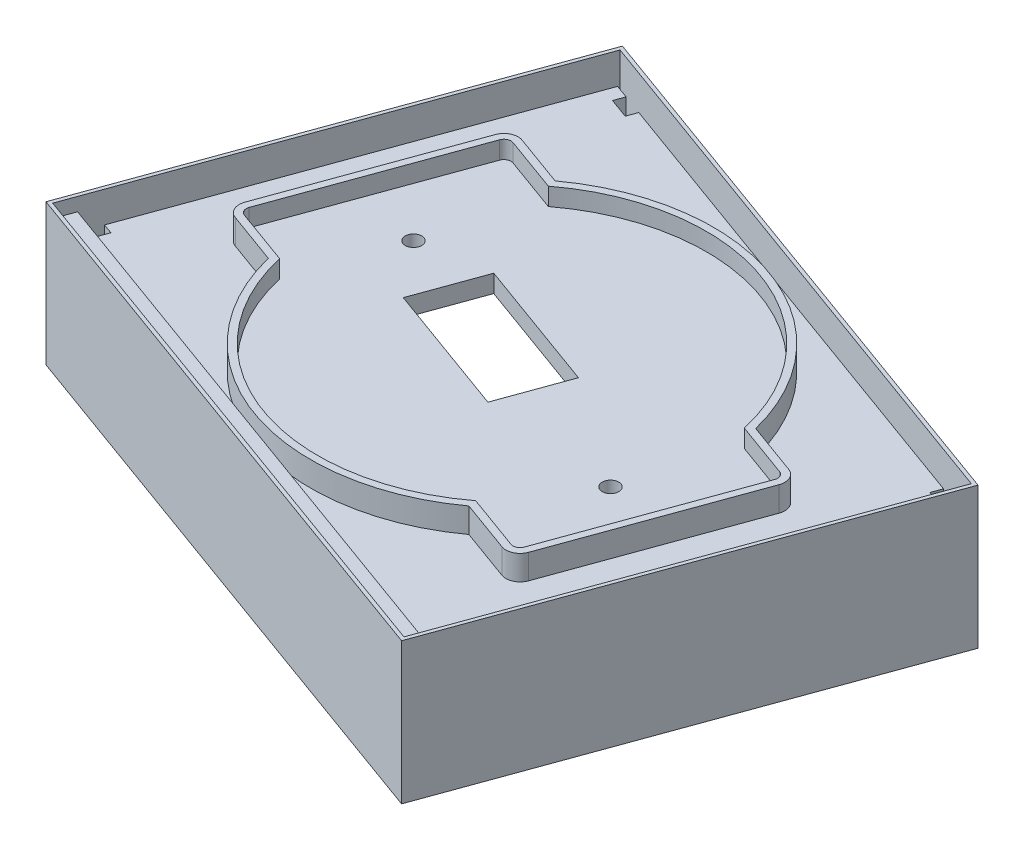
from build123d import *

# Parameters (mm, degrees)
EXTRUDE_1_DEPTH      = 50
SHELL_1_T            = -5
EXTRUDE_2_DEPTH      = 5
SKETCH_10_R          = 2.35
EXTRUDE_3_DEPTH      = 5
CUT_EXTRUDE_1_DEPTH  = 5
EXTRUDE_START        = -30
EXTRUDE_4_DEPTH      = 30
SHELL_START          = -13
SHELL_13_DEPTH       = 8
SHELL_START_2        = -43
SHELL_13_2_DEPTH     = 30
SHELL_13_3_OUTLINE_R = 4.35
SHELL_13_3_DEPTH     = 1
SHELL_START_3        = -8
SHELL_13_4_DEPTH     = 3
SHELL_START_4        = -5
SHELL_13_5_DEPTH     = 3
SHELL_13_6_DEPTH     = 26
CUT_EXTRUDE_2_DEPTH  = 144.120865122
CUT_EXTRUDE_3_DEPTH  = 5


# Read off the part's stored shape, not the designer's step: 凸台-拉伸4, 抽壳13
with BuildPart() as part:
    # 草图3 → 凸台-拉伸1 (new body)
    with BuildSketch(Plane(origin=(0, 0, 0), x_dir=(1, 0, 0), z_dir=(0, 1, 0))):
        Polygon((57.849497127, -89.790549593), (-101.961949946, -31.82244298), (-57.849497127, 89.790549593), (101.961949946, 31.82244298), align=None)
    extrude(amount=-EXTRUDE_1_DEPTH)

    # 抽壳1
    shell_1_openings = [part.faces().sort_by_distance(p)[0] for p in [
        (0, 0, 0),
    ]]
    offset(amount=SHELL_1_T, openings=shell_1_openings, kind=Kind.INTERSECTION)

    # 草图4 → 凸台-拉伸2 (add)
    with BuildSketch(Plane(origin=(0, -10, 0), x_dir=(1, 0, 0), z_dir=(0, 1, 0))):
        Polygon((-54.85410476, 83.385268602), (95.556668956, 28.827050613), (54.793783145, -83.551568403), (-95.616990571, -28.993350414), align=None)
        with BuildLine():
            Line((-33.405753886, 43.6927409), (-49.102625926, 49.386437869))
            ThreePointArc((-49.102625926, 49.386437869), (-50.631828553, 49.317990247), (-51.664738322, 48.188280923))
            Line((-51.664738322, 48.188280923), (-70.544015322, -3.859728807))
            ThreePointArc((-70.544015322, -3.859728807), (-70.4755677, -5.388931433), (-69.345858375, -6.421841203))
            Line((-69.345858375, -6.421841203), (-53.648986335, -12.115538173))
            ThreePointArc((-53.648986335, -12.115538173), (-18.754387434, -51.703703465), (33.405753886, -43.6927409))
            Line((33.405753886, -43.6927409), (49.102625926, -49.386437869))
            ThreePointArc((49.102625926, -49.386437869), (50.631828553, -49.317990247), (51.664738322, -48.188280923))
            Line((51.664738322, -48.188280923), (70.544015322, 3.859728807))
            ThreePointArc((70.544015322, 3.859728807), (70.4755677, 5.388931433), (69.345858375, 6.421841203))
            Line((69.345858375, 6.421841203), (53.648986335, 12.115538173))
            ThreePointArc((53.648986335, 12.115538173), (18.754387434, 51.703703465), (-33.405753886, 43.6927409))
        make_face(mode=Mode.SUBTRACT)
    extrude(amount=EXTRUDE_2_DEPTH)

    # 草图10 → 凸台-拉伸3 (add)
    with BuildSketch(Plane(origin=(0, -10, 0), x_dir=(1, 0, 0), z_dir=(0, 1, 0))):
        Polygon((-54.85410476, 83.385268602), (95.556668956, 28.827050613), (54.87017905, -83.340953621), (-95.540594666, -28.782735632), align=None)
        with Locations(Location((44.109349089, -16.22853422, 0), (0, 0, 270))):
            Circle(SKETCH_10_R, mode=Mode.SUBTRACT)
        with Locations(Location((-44.109349089, 16.22853422, 0), (0, 0, 270))):
            Circle(SKETCH_10_R, mode=Mode.SUBTRACT)
        Polygon((5.990784733, -12.810561982), (-31.611908696, 0.828992516), (-24.792131447, 19.63033923), (12.810561982, 5.990784733), align=None, mode=Mode.SUBTRACT)
    extrude(amount=-EXTRUDE_3_DEPTH)

    # 草图11 → 切除-拉伸1 (cut)
    with BuildSketch(Plane(origin=(0, -45, 0), x_dir=(1, 0, 0), z_dir=(0, 1, 0))):
        Polygon((57.849497127, -89.790549593), (101.961949946, 31.82244298), (-57.849497127, 89.790549593), (-101.961949946, -31.82244298), align=None)
    extrude(amount=-CUT_EXTRUDE_1_DEPTH, mode=Mode.SUBTRACT)

    # 凸台-拉伸4 outline → 凸台-拉伸4 (add)
    # profile 1 of 4: a face of its own
    with BuildSketch(Plane.XZ.offset(45).offset(EXTRUDE_START)):
        Polygon((92.146780331, -19.426377256), (82.746106974, -22.83626588), (86.155995598, -32.236939238), (95.556668956, -28.827050613), align=None)
        Polygon((91.713500361, -27.029815193), (87.953231018, -28.393770643), (86.589275569, -24.6335013), (90.349544911, -23.26954585), align=None, mode=Mode.SUBTRACT)
    # profile 2 of 4: a face of its own
    with BuildSketch(Plane.XZ.offset(45).offset(EXTRUDE_START)):
        Polygon((-54.85410476, -83.385268602), (-45.453403196, -79.975369746), (-48.863293462, -70.574691864), (-58.263966819, -73.984580488), align=None)
        Polygon((-49.296573432, -78.178129801), (-53.056842775, -79.542085251), (-54.420798224, -75.781815908), (-50.660528881, -74.417860458), align=None, mode=Mode.SUBTRACT)
    # profile 3 of 4: a face of its own
    with BuildSketch(Plane.XZ.offset(45).offset(EXTRUDE_START)):
        Polygon((49.11739228, 70.666865773), (58.263993385, 73.984595245), (54.87017905, 83.340953621), (54.85410476, 83.385268602), (45.453431403, 79.975379978), align=None)
        Polygon((50.660555447, 74.417875215), (49.296599998, 78.178144558), (53.05686934, 79.542100008), (54.42082479, 75.781830665), align=None, mode=Mode.SUBTRACT)
    # profile 4 of 4: a face of its own
    with BuildSketch(Plane.XZ.offset(45).offset(EXTRUDE_START)):
        Polygon((-95.540594666, 28.782735632), (-92.146780332, 19.426377256), (-82.746106974, 22.83626588), (-86.155995598, 32.236939238), (-95.556668956, 28.827050613), align=None)
        Polygon((-91.713500361, 27.029815193), (-87.953231018, 28.393770643), (-86.589275569, 24.6335013), (-90.349544911, 23.26954585), align=None, mode=Mode.SUBTRACT)
    extrude(amount=EXTRUDE_4_DEPTH)

    # 抽壳13 outline → 抽壳13 (cut)
    with BuildSketch(Plane(origin=(0, 0, 0), x_dir=(1, 0, 0), z_dir=(0, 1, 0)).offset(SHELL_START)):
        Polygon((-99.39983755, -30.624286033), (56.65134018, -87.228437197), (99.39983755, 30.624286033), (-56.65134018, 87.228437197), align=None)
        Polygon((57.432291447, -82.142796675), (56.052261707, -85.947380999), (-98.118781352, -30.02520756), (-96.738751612, -26.220623236), align=None, mode=Mode.SUBTRACT)
        with BuildLine():
            Line((-72.424149993, -3.177751082), (-53.544872994, 48.870258648))
            ThreePointArc((-53.544872994, 48.870258648), (-51.479053454, 51.129677297), (-48.420648201, 51.266572541))
            Line((-48.420648201, 51.266572541), (-33.739920947, 45.941459864))
            ThreePointArc((-33.739920947, 45.941459864), (19.436365158, 53.583838136), (55.347108846, 13.627088551))
            Line((55.347108846, 13.627088551), (70.0278361, 8.301975874))
            ThreePointArc((70.0278361, 8.301975874), (72.28725475, 6.236156335), (72.424149993, 3.177751082))
            Line((72.424149993, 3.177751082), (53.544872994, -48.870258648))
            ThreePointArc((53.544872994, -48.870258648), (51.479053454, -51.129677297), (48.420648201, -51.266572541))
            Line((48.420648201, -51.266572541), (33.739920947, -45.941459864))
            ThreePointArc((33.739920947, -45.941459864), (-19.436365158, -53.583838136), (-55.347108846, -13.627088551))
            Line((-55.347108846, -13.627088551), (-70.0278361, -8.301975874))
            ThreePointArc((-70.0278361, -8.301975874), (-72.28725475, -6.236156335), (-72.424149993, -3.177751082))
        make_face(mode=Mode.SUBTRACT)
    extrude(amount=SHELL_13_DEPTH, mode=Mode.SUBTRACT)

    # Shell 13 2 outline → Shell 13 2 (cut)
    with BuildSketch(Plane(origin=(0, 0, 0), x_dir=(1, 0, 0), z_dir=(0, 1, 0)).offset(SHELL_START_2)):
        Polygon((-99.39983755, -30.624286033), (56.65134018, -87.228437197), (99.39983755, 30.624286033), (-56.65134018, 87.228437197), align=None)
        Polygon((56.641948324, -75.523741054), (54.612089439, -81.119830088), (57.432291447, -82.142796675), (56.052261707, -85.947380999), (-98.118781352, -30.02520756), (-96.738751612, -26.220623236), (-93.918549605, -27.243589823), (-91.88869072, -21.64750079), (-94.708892728, -20.624534203), (-56.052261707, 85.947380999), (-52.291964157, 84.583415318), (-53.314932385, 81.763208785), (-47.674528371, 79.71727561), (-46.651560142, 82.537482143), (88.718107995, 33.435096184), (87.695141407, 30.614894177), (94.275612757, 28.22797214), (91.88869072, 21.64750079), (94.708892728, 20.624534203), (59.462150331, -76.546707641), align=None, mode=Mode.SUBTRACT)
    extrude(amount=SHELL_13_2_DEPTH, mode=Mode.SUBTRACT)

    # Shell 13 3 outline → Shell 13 3 (cut)
    with BuildSketch(Plane(origin=(0, 0, 0), x_dir=(1, 0, 0), z_dir=(0, 1, 0)).offset(SHELL_START)):
        with BuildLine():
            ThreePointArc((-48.420648201, 51.266572541), (-51.479053454, 51.129677297), (-53.544872994, 48.870258648))
            Line((-53.544872994, 48.870258648), (-72.424149993, -3.177751082))
            ThreePointArc((-72.424149993, -3.177751082), (-72.28725475, -6.236156335), (-70.0278361, -8.301975874))
            Line((-70.0278361, -8.301975874), (-55.347108846, -13.627088551))
            ThreePointArc((-55.347108846, -13.627088551), (-19.436365158, -53.583838136), (33.739920947, -45.941459864))
            Line((33.739920947, -45.941459864), (48.420648201, -51.266572541))
            ThreePointArc((48.420648201, -51.266572541), (51.479053454, -51.129677297), (53.544872994, -48.870258648))
            Line((53.544872994, -48.870258648), (72.424149993, 3.177751082))
            ThreePointArc((72.424149993, 3.177751082), (72.28725475, 6.236156335), (70.0278361, 8.301975874))
            Line((70.0278361, 8.301975874), (55.347108846, 13.627088551))
            ThreePointArc((55.347108846, 13.627088551), (19.436365158, 53.583838136), (-33.739920947, 45.941459864))
            Line((-33.739920947, 45.941459864), (-48.420648201, 51.266572541))
        make_face()
        with Locations((44.109349089, -16.22853422)):
            Circle(SHELL_13_3_OUTLINE_R, mode=Mode.SUBTRACT)
        with Locations((-44.109349089, 16.22853422)):
            Circle(SHELL_13_3_OUTLINE_R, mode=Mode.SUBTRACT)
        Polygon((15.372674378, 7.18894168), (7.18894168, -15.372674378), (-34.174021092, -0.369164431), (-25.990288394, 22.192451627), align=None, mode=Mode.SUBTRACT)
    extrude(amount=SHELL_13_3_DEPTH, mode=Mode.SUBTRACT)

    # Shell 13 4 outline → Shell 13 4 (cut)
    with BuildSketch(Plane(origin=(0, 0, 0), x_dir=(1, 0, 0), z_dir=(0, 1, 0)).offset(SHELL_START_3)):
        Polygon((56.052261707, -85.947380999), (57.432291447, -82.142796675), (-96.738751612, -26.220623236), (-98.118781352, -30.02520756), align=None)
    extrude(amount=SHELL_13_4_DEPTH, mode=Mode.SUBTRACT)

    # Shell 13 5 outline → Shell 13 5 (cut)
    with BuildSketch(Plane(origin=(0, 0, 0), x_dir=(1, 0, 0), z_dir=(0, 1, 0)).offset(SHELL_START_4)):
        Polygon((-99.39983755, -30.624286033), (56.65134018, -87.228437197), (99.39983755, 30.624286033), (-56.65134018, 87.228437197), align=None)
        Polygon((59.462150331, -76.546707641), (56.052261707, -85.947380999), (-98.118781352, -30.02520756), (-94.708892728, -20.624534203), (-56.052261707, 85.947380999), (-46.651560142, 82.537482143), (88.718107995, 33.435096184), (98.118781352, 30.02520756), (94.708892728, 20.624534203), align=None, mode=Mode.SUBTRACT)
    extrude(amount=SHELL_13_5_DEPTH, mode=Mode.SUBTRACT)

    # Shell 13 6 outline → Shell 13 6 (cut)
    with BuildSketch(Plane(origin=(0, 0, 0), x_dir=(1, 0, 0), z_dir=(0, 1, 0)).offset(SHELL_START_2)):
        Polygon((54.612089439, -81.119830088), (54.255026287, -82.104212404), (47.700648719, -79.726755316), (46.601460456, -82.519309577), (56.052261707, -85.947380999), (57.432291447, -82.142796675), align=None)
        Polygon((-94.275612757, -28.22797214), (-93.918549605, -27.243589823), (-96.738751612, -26.220623236), (-98.118781352, -30.02520756), (-88.718107995, -33.435096184), (-87.695141407, -30.614894177), align=None)
    extrude(amount=SHELL_13_6_DEPTH, mode=Mode.SUBTRACT)

    # 草图16 → 切除-拉伸2 (cut, through all)
    with BuildSketch(Plane.XZ.offset(45)):
        Polygon((-101.961949946, 31.82244298), (57.849497127, 89.790549593), (101.961949946, -31.82244298), (-57.849497127, -89.790549593), align=None)
        Polygon((-100.680893748, 31.223364506), (-57.250418654, -88.509493395), (100.680893748, -31.223364506), (57.250418654, 88.509493395), align=None, mode=Mode.SUBTRACT)
    extrude(amount=-CUT_EXTRUDE_2_DEPTH, mode=Mode.SUBTRACT)

    # 草图17 → 切除-拉伸3 (cut)
    with BuildSketch(Plane(origin=(0, 0, 0), x_dir=(1, 0, 0), z_dir=(0, 1, 0))):
        Polygon((57.250418654, -88.509493395), (-100.680893748, -31.223364506), (-57.250418654, 88.509493395), (100.680893748, 31.223364506), align=None)
    extrude(amount=-CUT_EXTRUDE_3_DEPTH, mode=Mode.SUBTRACT)


solid = part.part
